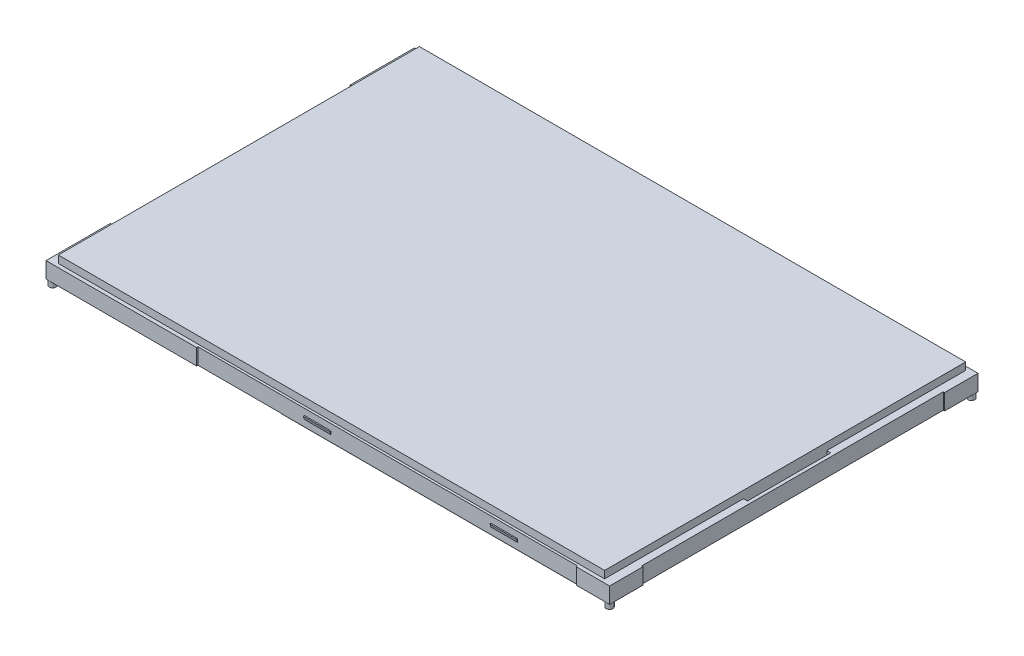
from build123d import *

# Parameters (mm, degrees)
SKETCH1_W                  = 84.6
SKETCH1_H                  = 55.3
BOSS_EXTRUDE1_DEPTH        = 2.4
SKETCH2_W                  = 82
SKETCH2_H                  = 54.2
BOSS_EXTRUDE2_DEPTH        = 1.1
SKETCH3_R                  = 0.5
BOSS_EXTRUDE3_DEPTH        = 0.8
CUT_EXTRUDE1_DEPTH         = 1
SKETCH5_W                  = 57
SKETCH5_H                  = 2.4
CUT_EXTRUDE2_DEPTH         = 0.2
SKETCH6_W                  = 45.3
SKETCH6_H                  = 2.4
CUT_EXTRUDE3_DEPTH         = 0.2
SKETCH7_W                  = 44.6
SKETCH7_H                  = 3
BOSS_EXTRUDE4_DEPTH        = 0.15
SKETCH8_W                  = 0.6
SKETCH8_H                  = 12.5
CUT_EXTRUDE4_DEPTH         = 1
SKETCH9_W                  = 4
SKETCH9_H                  = 0.5
BOSS_EXTRUDE5_DEPTH        = 0.2
CHAMFER1_SIZE              = 0.2
CHAMFER1_SIZE_2            = 0.549495484
CHAMFER1_OF_MIRROR4_SIZE   = 0.2
CHAMFER1_OF_MIRROR4_SIZE_2 = 0.549495484
SKETCH10_W                 = 36
SKETCH10_H                 = 1.5
CUT_EXTRUDE5_DEPTH         = 10
BOSS_EXTRUDE7_DEPTH        = 12.5
BOSS_EXTRUDE7_DEPTH_BACK   = 12.5


with BuildPart() as part:
    # Sketch1 → Boss-Extrude1 (new body)
    with BuildSketch(Plane(origin=(0, 0, 0), x_dir=(1, 0, 0), z_dir=(0, 1, 0))):
        Rectangle(SKETCH1_W, SKETCH1_H)
    extrude(amount=-BOSS_EXTRUDE1_DEPTH)

    # Sketch2 → Boss-Extrude2 (add)
    with BuildSketch(Plane(origin=(0, 0, 0), x_dir=(1, 0, 0), z_dir=(0, 1, 0))):
        Rectangle(SKETCH2_W, SKETCH2_H)
    extrude(amount=BOSS_EXTRUDE2_DEPTH)

    # Sketch3 → Boss-Extrude3 (add)
    with BuildSketch(Plane.XZ.offset(2.4)):
        with Locations(Location((-41.8, 27.15, 0), (0, 0, 90))):
            Circle(SKETCH3_R)
        with Locations(Location((41.8, 27.15, 0), (0, 0, 90))):
            Circle(SKETCH3_R)
        with Locations(Location((41.8, -27.15, 0), (0, 0, 270))):
            Circle(SKETCH3_R)
        with Locations(Location((-41.8, -27.15, 0), (0, 0, 270))):
            Circle(SKETCH3_R)
    extrude(amount=BOSS_EXTRUDE3_DEPTH)

    # Sketch4 → Cut-Extrude1 (cut)
    with BuildSketch(Plane.XZ.offset(2.4)):
        with BuildLine():
            Line((-39.7, -22.4), (-41.3, -22.4))
            ThreePointArc((-41.3, -22.4), (-41.724264069, -22.224264069), (-41.9, -21.8))
            Line((-41.9, -21.8), (-41.9, 21.8))
            ThreePointArc((-41.9, 21.8), (-41.724264069, 22.224264069), (-41.3, 22.4))
            Line((-41.3, 22.4), (-39.7, 22.4))
            ThreePointArc((-39.7, 22.4), (-39.275735931, 22.224264069), (-39.1, 21.8))
            Line((-39.1, 21.8), (-39.1, -21.8))
            ThreePointArc((-39.1, -21.8), (-39.275735931, -22.224264069), (-39.7, -22.4))
        make_face()
    extrude(amount=-CUT_EXTRUDE1_DEPTH, mode=Mode.SUBTRACT)

    # Sketch5 → Cut-Extrude2 (cut)
    with BuildSketch(Plane.XY.offset(27.65)):
        with Locations((8.8, -1.2)):
            Rectangle(SKETCH5_W, SKETCH5_H)
    cut_extrude2 = extrude(amount=-CUT_EXTRUDE2_DEPTH, mode=Mode.SUBTRACT)

    # Mirror1: Cut-Extrude2 across plane
    add(cut_extrude2.mirror(Plane.XY), mode=Mode.SUBTRACT)

    # Sketch6 → Cut-Extrude3 (cut)
    with BuildSketch(Plane(origin=(42.3, 0, 0), x_dir=(0, 0, -1), z_dir=(1, 0, 0))):
        with Locations((0, -1.2)):
            Rectangle(SKETCH6_W, SKETCH6_H)
    extrude(amount=-CUT_EXTRUDE3_DEPTH, mode=Mode.SUBTRACT)

    # Sketch7 → Boss-Extrude4 (add)
    with BuildSketch(Plane.XZ.offset(2.4)):
        with Locations((15, 25.85)):
            Rectangle(SKETCH7_W, SKETCH7_H)
    boss_extrude4 = extrude(amount=BOSS_EXTRUDE4_DEPTH)

    # Mirror2: Boss-Extrude4 across plane
    add(boss_extrude4.mirror(Plane.XY))

    # Sketch8 → Cut-Extrude4 (cut)
    with BuildSketch(Plane(origin=(0, 0, 0), x_dir=(1, 0, 0), z_dir=(0, 1, 0))):
        with Locations((41.3, 0)):
            Rectangle(SKETCH8_W, SKETCH8_H)
    extrude(amount=-CUT_EXTRUDE4_DEPTH, mode=Mode.SUBTRACT)

    # Sketch9 → Boss-Extrude5 (add)
    with BuildSketch(Plane.XY.offset(27.45)):
        with Locations((-1.7, -1.2)):
            Rectangle(SKETCH9_W, SKETCH9_H)
        with Locations((26.3, -1.2)):
            Rectangle(SKETCH9_W, SKETCH9_H)
    boss_extrude5 = extrude(amount=BOSS_EXTRUDE5_DEPTH)

    # Chamfer1
    # the kernel refuses this chamfer: 0.549495484, 0.2 mm, written as the material it takes off along each edge
    with BuildSketch(Plane(origin=(29.72549829, -1.45, 27.65), x_dir=(0, -0.0990409022520511, -0.9950833631817485), z_dir=(-1, 0, 0))) as chamfer1_piece_1_section:
        Polygon((CHAMFER1_SIZE * 0.995083363182, -CHAMFER1_SIZE * 0.0990409022521), (-CHAMFER1_SIZE_2 * 0.0990409022324, -CHAMFER1_SIZE_2 * 0.995083362984), (0, 0), align=None)
    chamfer1_piece_1 = extrude(amount=6.85099658, mode=Mode.PRIVATE)
    chamfer1_piece_1 = split(chamfer1_piece_1, bisect_by=Plane(origin=(26.3, -1.261493049, 27.45), z_dir=(0, 0, 1)), keep=Keep.TOP, mode=Mode.PRIVATE)
    add(chamfer1_piece_1, mode=Mode.SUBTRACT)
    with BuildSketch(Plane(origin=(1.72549829, -1.45, 27.65), x_dir=(0, -0.0990409022520511, -0.9950833631817485), z_dir=(-1, 0, 0))) as chamfer1_piece_2_section:
        Polygon((CHAMFER1_SIZE * 0.995083363182, -CHAMFER1_SIZE * 0.0990409022521), (-CHAMFER1_SIZE_2 * 0.0990409022324, -CHAMFER1_SIZE_2 * 0.995083362984), (0, 0), align=None)
    chamfer1_piece_2 = extrude(amount=6.85099658, mode=Mode.PRIVATE)
    chamfer1_piece_2 = split(chamfer1_piece_2, bisect_by=Plane(origin=(-1.7, -1.261493049, 27.45), z_dir=(0, 0, 1)), keep=Keep.TOP, mode=Mode.PRIVATE)
    add(chamfer1_piece_2, mode=Mode.SUBTRACT)

    # Mirror4: Boss-Extrude5 across plane
    add(boss_extrude5.mirror(Plane.XY))

    # Chamfer1 of Mirror4
    # the kernel refuses this chamfer: 0.549495484, 0.2 mm, written as the material it takes off along each edge
    with BuildSketch(Plane(origin=(29.72549829, -1.45, -27.65), x_dir=(0, -0.0990409022520511, 0.9950833631817485), z_dir=(-1, 0, 0))) as chamfer1_of_mirror4_piece_1_section:
        Polygon((CHAMFER1_OF_MIRROR4_SIZE * 0.995083363182, CHAMFER1_OF_MIRROR4_SIZE * 0.0990409022521), (-CHAMFER1_OF_MIRROR4_SIZE_2 * 0.0990409022324, CHAMFER1_OF_MIRROR4_SIZE_2 * 0.995083362984), (0, 0), align=None)
    chamfer1_of_mirror4_piece_1 = extrude(amount=6.85099658, mode=Mode.PRIVATE)
    chamfer1_of_mirror4_piece_1 = split(chamfer1_of_mirror4_piece_1, bisect_by=Plane(origin=(26.3, -1.261493049, -27.45), z_dir=(0, 0, -1)), keep=Keep.TOP, mode=Mode.PRIVATE)
    add(chamfer1_of_mirror4_piece_1, mode=Mode.SUBTRACT)
    with BuildSketch(Plane(origin=(1.72549829, -1.45, -27.65), x_dir=(0, -0.0990409022520511, 0.9950833631817485), z_dir=(-1, 0, 0))) as chamfer1_of_mirror4_piece_2_section:
        Polygon((CHAMFER1_OF_MIRROR4_SIZE * 0.995083363182, CHAMFER1_OF_MIRROR4_SIZE * 0.0990409022521), (-CHAMFER1_OF_MIRROR4_SIZE_2 * 0.0990409022324, CHAMFER1_OF_MIRROR4_SIZE_2 * 0.995083362984), (0, 0), align=None)
    chamfer1_of_mirror4_piece_2 = extrude(amount=6.85099658, mode=Mode.PRIVATE)
    chamfer1_of_mirror4_piece_2 = split(chamfer1_of_mirror4_piece_2, bisect_by=Plane(origin=(-1.7, -1.261493049, -27.45), z_dir=(0, 0, -1)), keep=Keep.TOP, mode=Mode.PRIVATE)
    add(chamfer1_of_mirror4_piece_2, mode=Mode.SUBTRACT)

    # Sketch10 → Cut-Extrude5 (cut)
    with BuildSketch(Plane.ZY.offset(42.3)):
        with Locations((0, -0.75)):
            Rectangle(SKETCH10_W, SKETCH10_H)
    extrude(amount=-CUT_EXTRUDE5_DEPTH, mode=Mode.SUBTRACT)

    # Sketch13 → Boss-Extrude7 (add, two sides: drawn at the far end of the back side and taken through both)
    with BuildSketch(Plane.XY.offset(-BOSS_EXTRUDE7_DEPTH_BACK)):
        with BuildLine():
            Line((-42.05, -0.75), (-32.3, -0.75))
            Line((-32.3, -0.75), (-32.3, -0.65))
            Line((-32.3, -0.65), (-42.058857344, -0.65))
            ThreePointArc((-42.058857344, -0.65), (-42.962715901, -1.720353295), (-42.068005903, -2.798365581))
            Line((-42.068005903, -2.798365581), (-27.318842711, -5.498212402))
            add(Edge.make_bspline(
                [(-27.318842711, -5.498212402), (-27.055971917, -5.550974674), (-26.517605359, -5.672128419), (-25.572291866, -5.932507667), (-24.521729024, -6.300209586), (-23.417642306, -6.772863788), (-22.38181971, -7.248072884), (-21.335698344, -7.694021321), (-20.202294115, -8.077787346), (-19.113789609, -8.318235721), (-18.133663704, -8.446100314), (-17.574099695, -8.487090287), (-17.302374167, -8.5)],
                knots=[6.323e-05, 6.323e-05, 6.323e-05, 6.323e-05, 0.062570215, 0.125077199, 0.250091168, 0.375105137, 0.500119106, 0.625133075, 0.750147043, 0.875161012, 0.937667997, 1.000174981, 1.000174981, 1.000174981, 1.000174981], degree=3))
            Line((-17.302374167, -8.5), (-4.8, -8.5))
            Line((-4.8, -8.5), (-4.8, -8.4))
            Line((-4.8, -8.4), (-17.3, -8.4))
            add(Edge.make_bspline(
                [(-27.3, -5.4), (-22.890715179, -6.284799168), (-21.81761674, -8.185367475), (-17.3, -8.4)],
                knots=[0, 0, 0, 0, 1, 1, 1, 1], degree=3))
            Line((-27.3, -5.4), (-42.05, -2.7))
            ThreePointArc((-42.05, -2.7), (-42.862725794, -1.725), (-42.05, -0.75))
        make_face()
        with BuildLine():
            Line((-32.3, -0.85), (-32.3, -0.75))
            Line((-32.3, -0.75), (-42.05, -0.75))
            ThreePointArc((-42.05, -0.75), (-42.862725794, -1.725), (-42.05, -2.7))
            Line((-42.05, -2.7), (-27.3, -5.4))
            add(Edge.make_bspline(
                [(-27.3, -5.4), (-22.890715179, -6.284799168), (-21.81761674, -8.185367475), (-17.3, -8.4)],
                knots=[0, 0, 0, 0, 1, 1, 1, 1], degree=3))
            Line((-17.3, -8.4), (-4.8, -8.4))
            Line((-4.8, -8.4), (-4.8, -8.3))
            Line((-4.8, -8.3), (-17.297622246, -8.3))
            add(Edge.make_bspline(
                [(-27.281158431, -5.301787389), (-27.015284827, -5.35513952), (-26.470914345, -5.477568661), (-25.513851699, -5.741064097), (-24.450268814, -6.113231913), (-23.336923139, -6.589854571), (-22.30113605, -7.06504573), (-21.26539226, -7.506542017), (-20.151183505, -7.883950719), (-19.082330822, -8.120417996), (-18.117886975, -8.246552851), (-17.565625944, -8.287228528), (-17.297622246, -8.3)],
                knots=[-6.2969e-05, -6.2969e-05, -6.2969e-05, -6.2969e-05, 0.062429979, 0.124922927, 0.249908823, 0.37489472, 0.499880616, 0.624866512, 0.749852409, 0.874838305, 0.937331253, 0.999824201, 0.999824201, 0.999824201, 0.999824201], degree=3))
            Line((-27.281158431, -5.301787389), (-42.031994097, -2.601634419))
            ThreePointArc((-42.031994097, -2.601634419), (-42.762714839, -1.729418922), (-42.040679496, -0.85))
            Line((-42.040679496, -0.85), (-32.3, -0.85))
        make_face()
    extrude(amount=BOSS_EXTRUDE7_DEPTH + BOSS_EXTRUDE7_DEPTH_BACK)


solid = part.part
